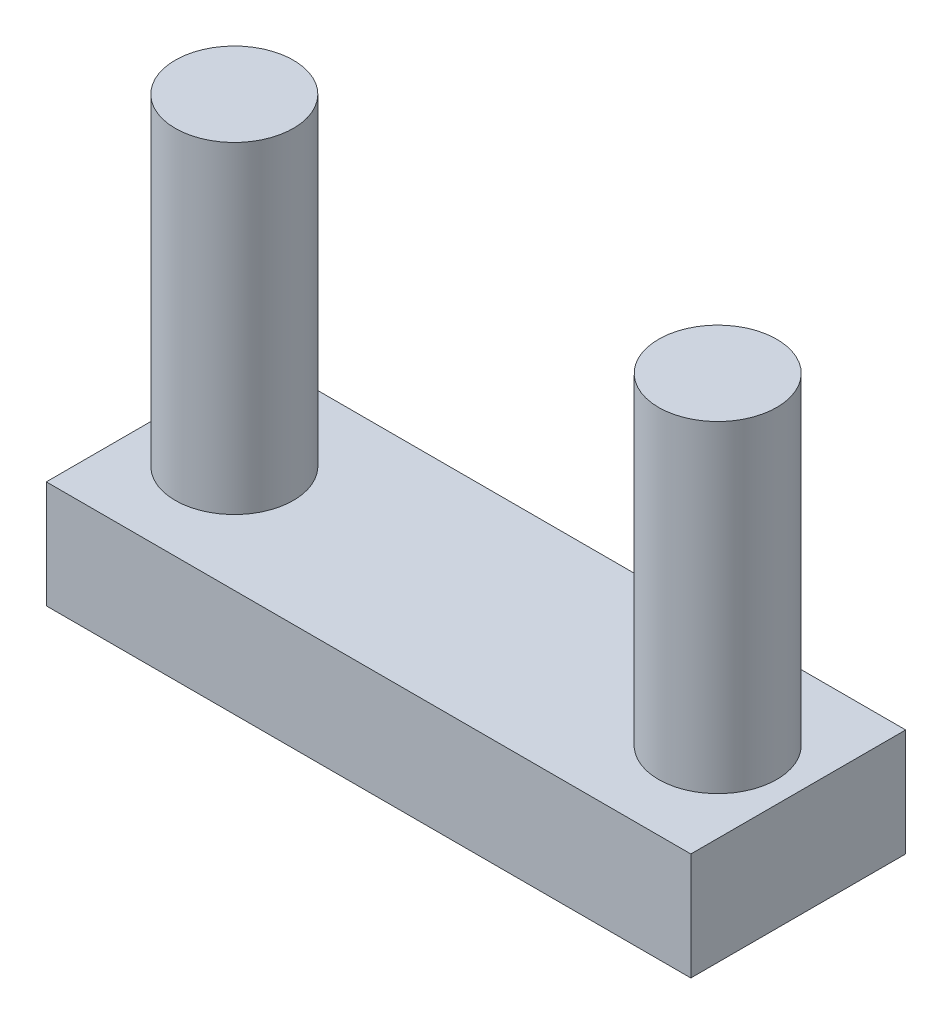
from build123d import *

# Parameters (mm, degrees)
SKETCH1_W           = 30
SKETCH1_H           = 10
SKETCH1_R           = 2.75
BOSS_EXTRUDE1_DEPTH = 5
SKETCH1_2_R         = 2.75
BOSS_EXTRUDE2_DEPTH = 20


with BuildPart() as part:
    # Sketch1 → Boss-Extrude1 (new body)
    with BuildSketch(Plane(origin=(0, 0, 0), x_dir=(1, 0, 0), z_dir=(0, 1, 0))):
        with Locations((11.25, 0)):
            Rectangle(SKETCH1_W, SKETCH1_H)
        Circle(SKETCH1_R, mode=Mode.SUBTRACT)
        with Locations((22.5, 0)):
            Circle(SKETCH1_R, mode=Mode.SUBTRACT)
    extrude(amount=BOSS_EXTRUDE1_DEPTH)

    # Sketch1<2> → Boss-Extrude2 (add)
    with BuildSketch(Plane(origin=(0, 0, 0), x_dir=(1, 0, 0), z_dir=(0, 1, 0))):
        Circle(SKETCH1_2_R)
        with Locations((22.5, 0)):
            Circle(SKETCH1_2_R)
    extrude(amount=BOSS_EXTRUDE2_DEPTH)


solid = part.part
